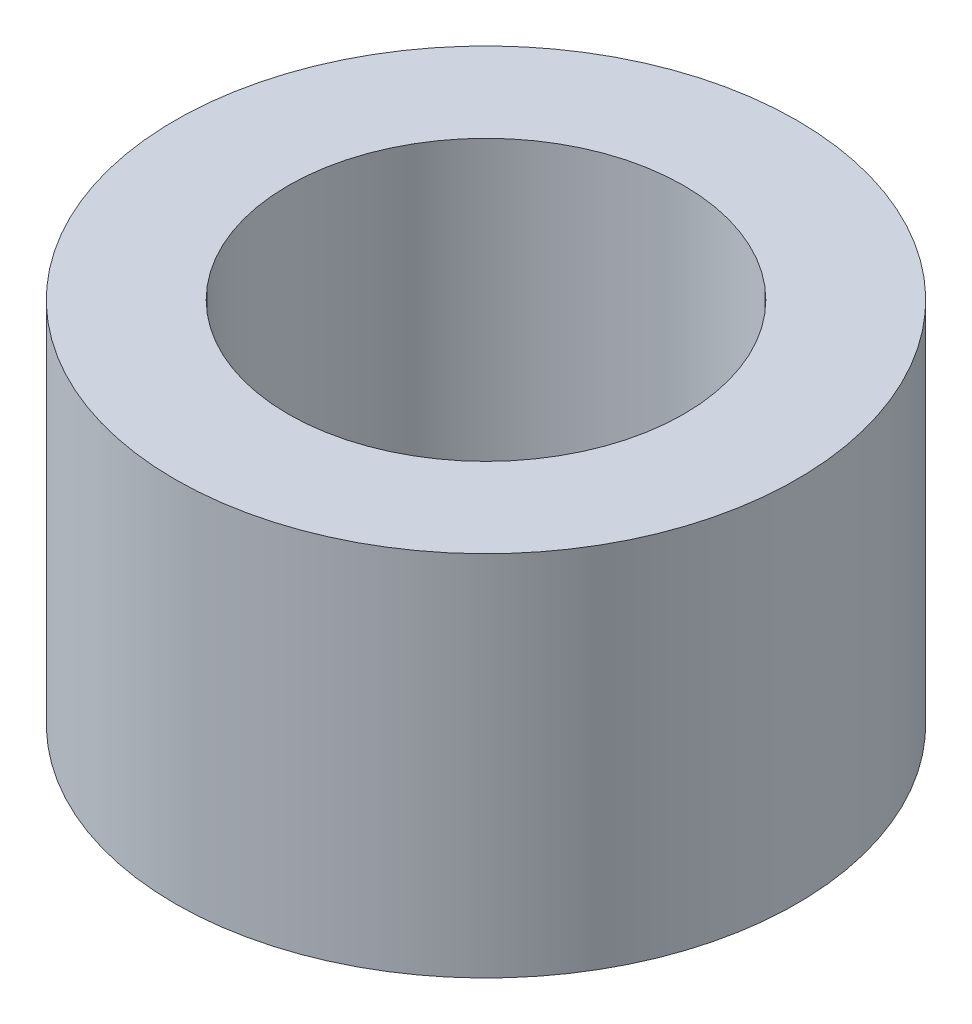
from build123d import *

# Parameters (mm, degrees)
CROQUIS1_R              = 11
CROQUIS1_R_2            = 7
SALIENTE_EXTRUIR1_DEPTH = 13


with BuildPart() as part:
    # Croquis1 → Saliente-Extruir1 (new body)
    with BuildSketch(Plane(origin=(0, 0, 0), x_dir=(1, 0, 0), z_dir=(0, 1, 0))):
        Circle(CROQUIS1_R)
        Circle(CROQUIS1_R_2, mode=Mode.SUBTRACT)
    extrude(amount=SALIENTE_EXTRUIR1_DEPTH)


solid = part.part
